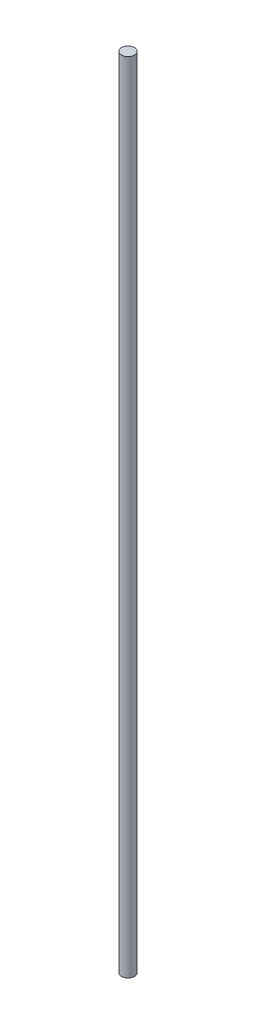
from build123d import *

# Parameters (mm, degrees)
SKETCH1_R           = 4
BOSS_EXTRUDE1_DEPTH = 489.05


with BuildPart() as part:
    # Sketch1 → Boss-Extrude1 (new body)
    with BuildSketch(Plane(origin=(0, 0, 0), x_dir=(1, 0, 0), z_dir=(0, 1, 0))):
        Circle(SKETCH1_R)
    extrude(amount=BOSS_EXTRUDE1_DEPTH)


solid = part.part
